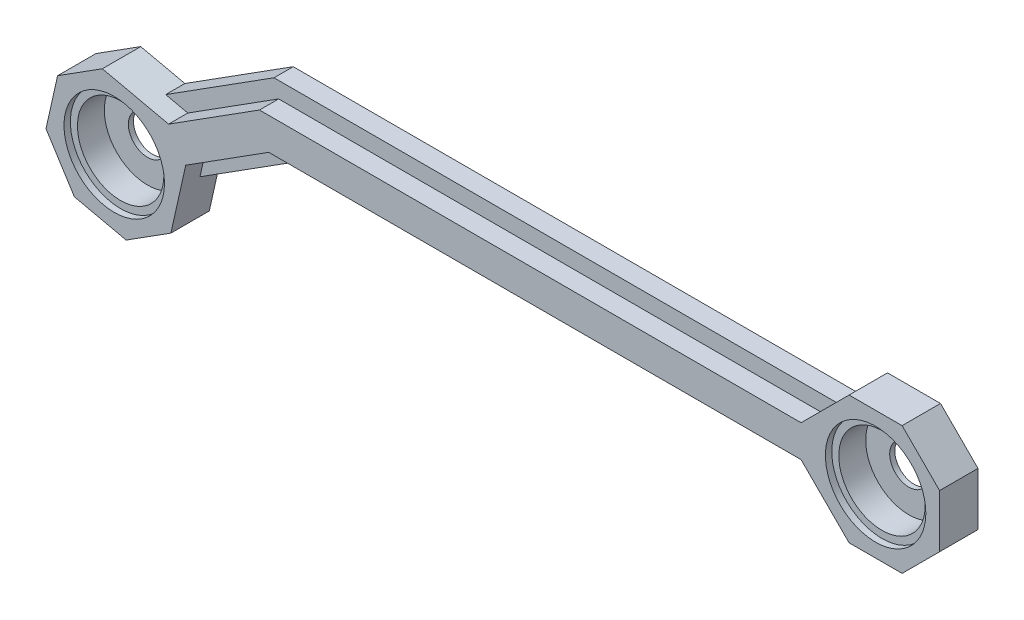
from build123d import *
from build123d.topology import SkipClean

# Parameters (mm, degrees)
SKETCH1_R           = 3
BOSS_EXTRUDE1_DEPTH = 6
BOSS_EXTRUDE2_DEPTH = 3
SKETCH3_R           = 7.85
CUT_EXTRUDE1_DEPTH  = 1
SKETCH4_R           = 6.75
CUT_EXTRUDE2_DEPTH  = 5.2
SKETCH5_W           = 10.298947731
SKETCH5_H           = 6.677630872
BOSS_EXTRUDE3_DEPTH = 0.8
SKETCH6_R           = 3
CUT_EXTRUDE3_DEPTH  = 0.8
BOSS_EXTRUDE5_START = -6
SKETCH7_R           = 9.071835919
SKETCH7_R_2         = 3
SKETCH7_R_3         = 8.53010645
BOSS_EXTRUDE5_DEPTH = 6
SKETCH8_R           = 7.85
CUT_EXTRUDE4_DEPTH  = 1
SKETCH9_R           = 6.75
CUT_EXTRUDE5_DEPTH  = 5.2
BOSS_EXTRUDE6_DEPTH = 3
CUT_EXTRUDE10_DEPTH = 3


with BuildPart() as part:
    # Sketch1 → Boss-Extrude1 (new body)
    with BuildSketch(Plane.XY):
        Polygon((-110.111909454, -21.080132017), (-108.303340642, -12.995688378), (-107.796344392, -10.729375598), (-94.823919433, -2.5), (-11.642135624, -2.5), (-10, -4.142135624), (-4.142135624, -10), (4.142135624, -10), (10, -4.142135624), (10, 4.142135624), (4.142135624, 10), (-4.142135624, 10), (-11.642135624, 2.5), (-96.276080567, 2.5), (-110.474741511, -6.507268438), (-120.82549793, -4.191703376), (-127.82091412, -8.629417024), (-129.629482932, -16.713860663), (-125.191769284, -23.709276854), (-117.107325644, -25.517845665), align=None)
        with Locations((-118.966411787, -14.85477452)):
            Circle(SKETCH1_R, mode=Mode.SUBTRACT)
        with Locations((-0.876614201, 0)):
            Circle(SKETCH1_R, mode=Mode.SUBTRACT)
    extrude(amount=-BOSS_EXTRUDE1_DEPTH)

    # Sketch2 → Boss-Extrude2 (add)
    with BuildSketch(Plane.XY):
        Polygon((-113.924993651, -5.735413417), (-110.474741511, -6.507268438), (-96.276080567, 2.5), (-11.642135624, 2.5), (-9.142135624, 5), (-97.002161134, 5), align=None)
        Polygon((-108.568199413, -14.179627738), (-107.796344392, -10.729375598), (-94.823919433, -2.5), (-11.642135624, -2.5), (-9.142135624, -5), (-94.097838866, -5), align=None)
    extrude(amount=-BOSS_EXTRUDE2_DEPTH)

    # Sketch3 → Cut-Extrude1 (cut)
    with BuildSketch(Plane(origin=(0, 0, -6), x_dir=(-1, 0, 0), z_dir=(0, 0, -1))):
        Circle(SKETCH3_R)
        with Locations((118.966411787, -14.85477452)):
            Circle(SKETCH3_R)
    extrude(amount=-CUT_EXTRUDE1_DEPTH, mode=Mode.SUBTRACT)

    # Sketch4 → Cut-Extrude2 (cut)
    with BuildSketch(Plane(origin=(0, 0, -6), x_dir=(-1, 0, 0), z_dir=(0, 0, -1))):
        Circle(SKETCH4_R)
        with Locations((118.966411787, -14.85477452)):
            Circle(SKETCH4_R)
    extrude(amount=-CUT_EXTRUDE2_DEPTH, mode=Mode.SUBTRACT)

    # Sketch5 → Boss-Extrude3 (add)
    with BuildSketch(Plane.XY):
        with Locations((-0.876614202, 0)):
            Rectangle(SKETCH5_W, SKETCH5_H)
    extrude(amount=-BOSS_EXTRUDE3_DEPTH)

    # Sketch6 → Cut-Extrude3 (cut)
    with BuildSketch(Plane.XY):
        Circle(SKETCH6_R)
    extrude(amount=-CUT_EXTRUDE3_DEPTH, mode=Mode.SUBTRACT)

    # Sketch7 → Boss-Extrude5 (add)
    # profile 1 of 2: a face of its own
    with SkipClean():  # the faces are left unmerged after this step: merging them gives an invalid solid
        with BuildSketch(Plane(origin=(0, 0, -6), x_dir=(-1, 0, 0), z_dir=(0, 0, -1)).offset(BOSS_EXTRUDE5_START)):
            Circle(SKETCH7_R)
            Circle(SKETCH7_R_2, mode=Mode.SUBTRACT)
        # profile 2 of 2: a face of its own
        with BuildSketch(Plane(origin=(0, 0, -6), x_dir=(-1, 0, 0), z_dir=(0, 0, -1)).offset(BOSS_EXTRUDE5_START)):
            with Locations((118.966411787, -14.85477452)):
                Circle(SKETCH7_R_3)
            with Locations((118.966411787, -14.85477452)):
                Circle(SKETCH7_R_2, mode=Mode.SUBTRACT)
        extrude(amount=BOSS_EXTRUDE5_DEPTH)

    # Sketch8 → Cut-Extrude4 (cut)
    with BuildSketch(Plane.XY):
        with Locations((-118.966411787, -14.85477452)):
            Circle(SKETCH8_R)
        Circle(SKETCH8_R)
    extrude(amount=-CUT_EXTRUDE4_DEPTH, mode=Mode.SUBTRACT)

    # Sketch9 → Cut-Extrude5 (cut)
    with BuildSketch(Plane.XY):
        with Locations((-118.966411787, -14.85477452)):
            Circle(SKETCH9_R)
        Circle(SKETCH9_R)
    extrude(amount=-CUT_EXTRUDE5_DEPTH, mode=Mode.SUBTRACT)

    # Sketch10 → Boss-Extrude6 (add)
    with BuildSketch(Plane(origin=(0, 0, -3), x_dir=(-1, 0, 0), z_dir=(0, 0, -1))):
        Polygon((9.142135624, -5), (11.642135624, -2.5), (94.823919433, -2.5), (107.796344392, -10.729375598), (108.568199413, -14.179627738), (94.097838866, -5), align=None)
        Polygon((9.142135624, 5), (11.642135624, 2.5), (96.276080567, 2.5), (110.474741511, -6.507268438), (113.924993651, -5.735413417), (97.002161134, 5), align=None)
    extrude(amount=BOSS_EXTRUDE6_DEPTH)

    # Sketch11 → Cut-Extrude10 (cut)
    with BuildSketch(Plane.XY):
        Polygon((-94.823919433, -2.5), (-107.796344392, -10.729375598), (-108.568199413, -14.179627738), (-94.097838866, -5), (-9.142135624, -5), (-11.642135624, -2.5), align=None)
        Polygon((-97.002161134, 5), (-113.924993651, -5.735413417), (-110.474741511, -6.507268438), (-96.276080567, 2.5), (-11.642135624, 2.5), (-9.142135624, 5), align=None)
    extrude(amount=-CUT_EXTRUDE10_DEPTH, mode=Mode.SUBTRACT)


solid = part.part
